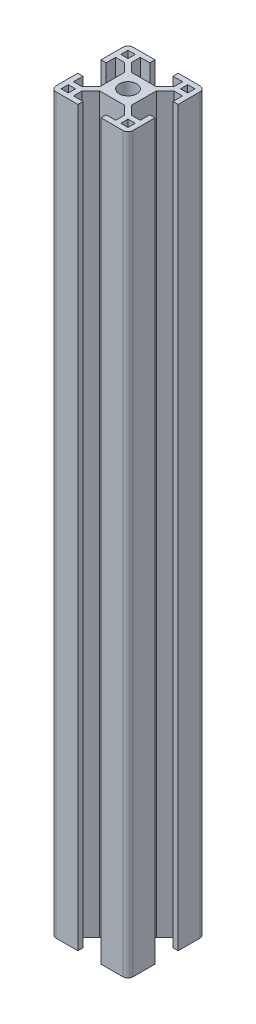
from build123d import *

# Parameters (mm, degrees)
SKETCH1_W           = 20
SKETCH1_H           = 20
EXTRUDE1_DEPTH      = 190
SKETCH2_R           = 2.266666667
SKETCH2_W           = 1.866666667
SKETCH2_H           = 1.866666667
EXTRUDE2_DEPTH      = 191.525588833
FILLET1_R           = 1.333333333
SKETCH_1_R          = 2.5
CUT_EXTRUDE_1_DEPTH = 192.311264697


with BuildPart() as part:
    # Sketch1 → Extrude1 (new body)
    with BuildSketch(Plane(origin=(0, 0, 0), x_dir=(1, 0, 0), z_dir=(0, 1, 0))):
        Rectangle(SKETCH1_W, SKETCH1_H)
    extrude(amount=EXTRUDE1_DEPTH)

    # Sketch2 → Extrude2 (cut, through all)
    with BuildSketch(Plane(origin=(0, 190, 0), x_dir=(1, 0, 0), z_dir=(0, 1, 0))):
        Circle(SKETCH2_R)
        Polygon((8.666666667, 3), (11.333333333, 3), (11.333333333, -3), (8.666666667, -3), (8.666666667, -5.466666667), (6.409475708, -5.466666667), (4.133333333, -3.190524292), (4.133333333, 3.190524292), (6.409475708, 5.466666667), (8.666666667, 5.466666667), align=None)
        with Locations((7.733333334, 7.733333334)):
            Rectangle(SKETCH2_W, SKETCH2_H)
        Polygon((-3.190524292, 4.133333333), (-5.466666667, 6.409475708), (-5.466666667, 8.666666667), (-3, 8.666666667), (-3, 11.333333333), (3, 11.333333333), (3, 8.666666667), (5.466666667, 8.666666667), (5.466666667, 6.409475708), (3.190524292, 4.133333333), align=None)
        with Locations((7.733333334, -7.733333334)):
            Rectangle(SKETCH2_W, SKETCH2_H)
        with Locations((-7.733333334, 7.733333334)):
            Rectangle(SKETCH2_W, SKETCH2_H)
        with Locations((-7.733333334, -7.733333334)):
            Rectangle(SKETCH2_W, SKETCH2_H)
        Polygon((-6.409475708, -5.466666667), (-8.666666667, -5.466666667), (-8.666666667, -3), (-11.333333333, -3), (-11.333333333, 3), (-8.666666667, 3), (-8.666666667, 5.466666667), (-6.409475708, 5.466666667), (-4.133333333, 3.190524292), (-4.133333333, -3.190524292), align=None)
        Polygon((3.190524292, -4.133333333), (-3.190524292, -4.133333333), (-5.466666667, -6.409475708), (-5.466666667, -8.666666667), (-3, -8.666666667), (-3, -11.333333333), (3, -11.333333333), (3, -8.666666667), (5.466666667, -8.666666667), (5.466666667, -6.409475708), align=None)
    extrude(amount=-EXTRUDE2_DEPTH, mode=Mode.SUBTRACT)

    # Fillet1
    fillet1_edges = [part.edges().sort_by_distance(p)[0] for p in [
        (10, 95, 10),
        (10, 95, -10),
        (-10, 95, 10),
        (-10, 95, -10),
    ]]
    fillet(fillet1_edges, radius=FILLET1_R)

    # Эскиз1 → Вырез-Вытянуть1 (cut, through all)
    with BuildSketch(Plane(origin=(10, 0, 0), x_dir=(0, 0, -1), z_dir=(1, 0, 0))):
        with Locations((0, 93)):
            Circle(SKETCH_1_R)
        with Locations((0, 107)):
            Circle(SKETCH_1_R)
    extrude(amount=-CUT_EXTRUDE_1_DEPTH, mode=Mode.SUBTRACT)


solid = part.part
